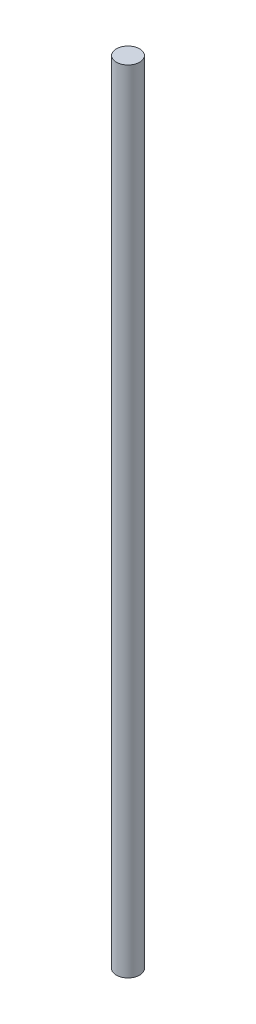
from build123d import *

# Parameters (mm, degrees)
SKETCH1_R           = 2.5
BOSS_EXTRUDE1_DEPTH = 170


with BuildPart() as part:
    # Sketch1 → Boss-Extrude1 (new body)
    with BuildSketch(Plane(origin=(0, 0, 0), x_dir=(1, 0, 0), z_dir=(0, 1, 0))):
        Circle(SKETCH1_R)
    extrude(amount=BOSS_EXTRUDE1_DEPTH)


solid = part.part
